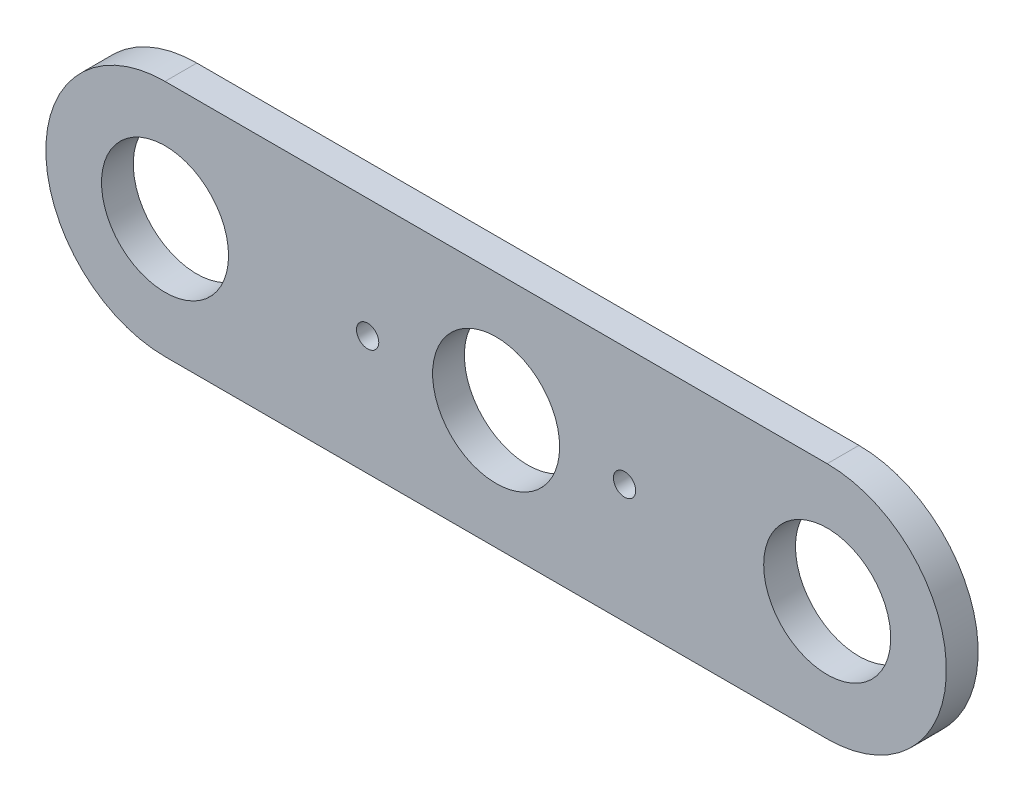
from build123d import *

# Parameters (mm, degrees)
SKETCH2_R           = 11.99
BOSS_EXTRUDE1_DEPTH = 6
SKETCH3_R           = 2.1
CUT_EXTRUDE1_DEPTH  = 10


with BuildPart() as part:
    # Sketch2 → Boss-Extrude1 (new body)
    with BuildSketch(Plane.XY):
        with BuildLine():
            Line((-62.5, -22.5), (62.5, -22.5))
            ThreePointArc((62.5, -22.5), (85, 0), (62.5, 22.5))
            Line((62.5, 22.5), (-62.5, 22.5))
            ThreePointArc((-62.5, 22.5), (-85, 0), (-62.5, -22.5))
        make_face()
        with Locations((-62.5, 0)):
            Circle(SKETCH2_R, mode=Mode.SUBTRACT)
        with Locations((62.5, 0)):
            Circle(SKETCH2_R, mode=Mode.SUBTRACT)
        Circle(SKETCH2_R, mode=Mode.SUBTRACT)
    extrude(amount=BOSS_EXTRUDE1_DEPTH)

    # Sketch3 → Cut-Extrude1 (cut)
    with BuildSketch(Plane.XY.offset(6)):
        with Locations((-24.25, 0)):
            Circle(SKETCH3_R)
        with Locations((24.25, 0)):
            Circle(SKETCH3_R)
    extrude(amount=-CUT_EXTRUDE1_DEPTH, mode=Mode.SUBTRACT)


solid = part.part
